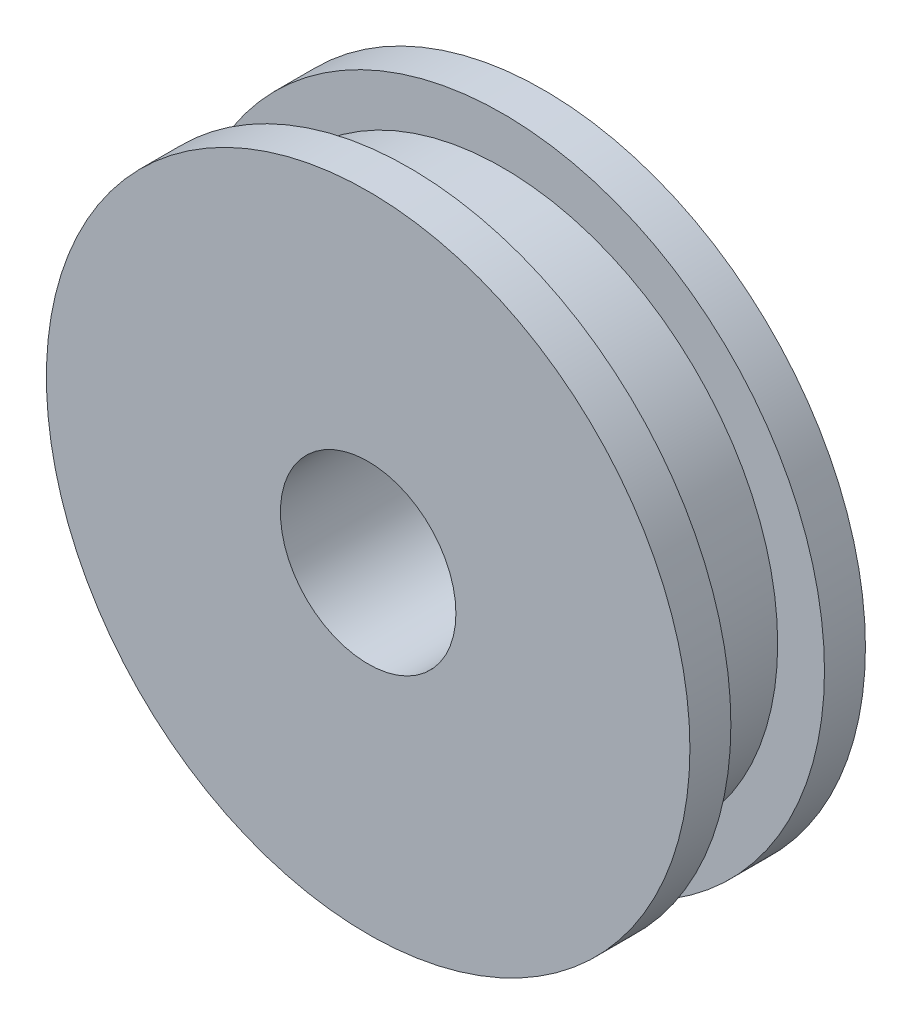
from build123d import *

# Parameters (mm, degrees)
ESBO_O1_R                = 5.5
RESSALTO_EXTRUS_O1_DEPTH = 1.5
ESBO_O3_R                = 1.5
CORTE_EXTRUS_O2_DEPTH    = 9.336666
ESBO_O5_W                = 0.8
ESBO_O5_H                = 1.6


with BuildPart() as part:
    # Esboço1 → Ressalto-extrusão1 (new, symmetric)
    with BuildSketch(Plane.XY):
        Circle(ESBO_O1_R)
    extrude(amount=RESSALTO_EXTRUS_O1_DEPTH, both=True)

    # Esboço3 → Corte-extrusão2 (cut, through all)
    with BuildSketch(Plane.XY.offset(1.5)):
        Circle(ESBO_O3_R)
    extrude(amount=-CORTE_EXTRUS_O2_DEPTH, mode=Mode.SUBTRACT)

    # Esboço5 → Corte-Revolução1 (revolve, cut)
    with BuildSketch(Plane(origin=(0, 0, 0), x_dir=(1, 0, 0), z_dir=(0, 1, 0))):
        with Locations((5.1, 0)):
            Rectangle(ESBO_O5_W, ESBO_O5_H)
    revolve(axis=Axis((0, 0, 1.5), (0, 0, -1)), mode=Mode.SUBTRACT)


solid = part.part
